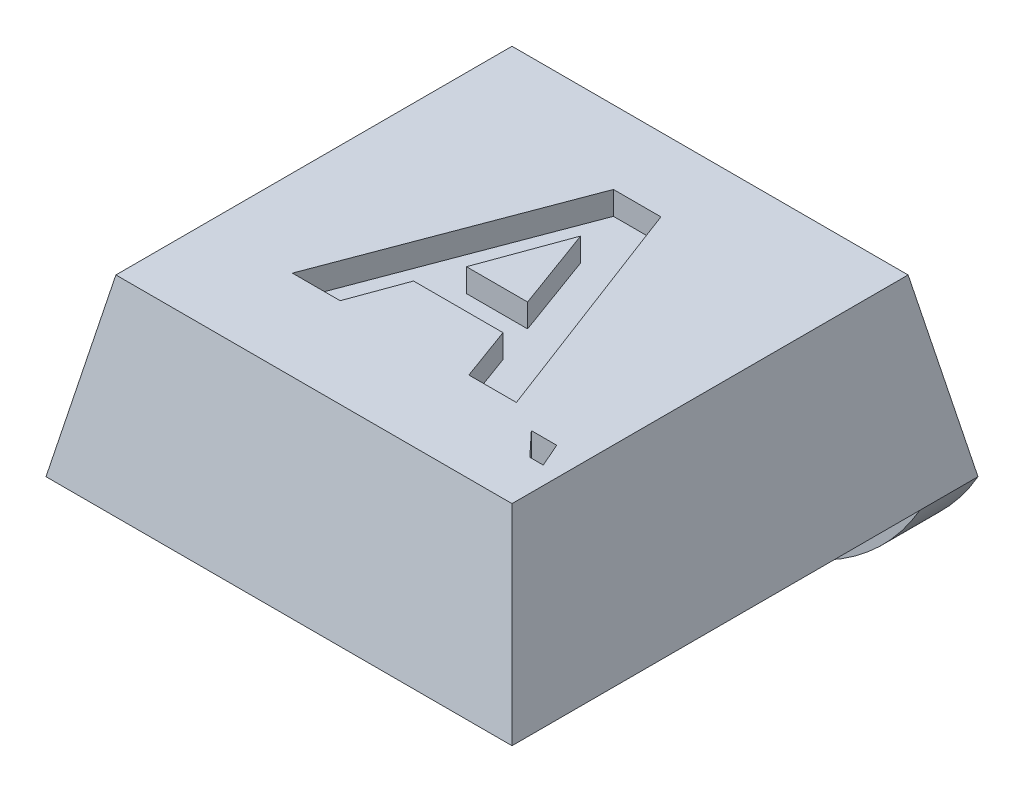
from build123d import *

# Parameters (mm, degrees)
SKETCH1_W               = 8
SKETCH1_H               = 8
BOSS_EXTRUDE1_DEPTH     = 3
CUT_EXTRUDE1_DEPTH      = 12.704699911
CUT_EXTRUDE1_DEPTH_BACK = 12.704699911
CUT_EXTRUDE2_DEPTH      = 11
SKETCH4_R               = 1.75
CUT_EXTRUDE3_DEPTH      = 0.4
SKETCH5_W               = 8
SKETCH5_H               = 1
BOSS_EXTRUDE2_DEPTH     = 2
FILLET1_R               = 4
CUT_EXTRUDE4_DEPTH      = 0.4
CUT_EXTRUDE5_DEPTH      = 0.5


with BuildPart() as part:
    # Sketch1 → Boss-Extrude1 (new body)
    with BuildSketch(Plane(origin=(0, 0, 0), x_dir=(1, 0, 0), z_dir=(0, 1, 0))):
        with Locations((4, 4)):
            Rectangle(SKETCH1_W, SKETCH1_H)
    extrude(amount=BOSS_EXTRUDE1_DEPTH)

    # Sketch2 → Cut-Extrude1 (cut, two sides: drawn at the far end of the back side and taken through both)
    with BuildSketch(Plane.XY.offset(-CUT_EXTRUDE1_DEPTH_BACK)):
        Polygon((0, 0), (0.6, 3), (0, 3), align=None)
        Polygon((8, 0), (7.4, 3), (8, 3), align=None)
    extrude(amount=CUT_EXTRUDE1_DEPTH + CUT_EXTRUDE1_DEPTH_BACK, mode=Mode.SUBTRACT)

    # Sketch3 → Cut-Extrude2 (cut)
    with BuildSketch(Plane(origin=(0, 0, 0), x_dir=(0, 0, -1), z_dir=(1, 0, 0))):
        Polygon((0, 0), (0.6, 3), (0, 3), align=None)
        Polygon((8, 3), (7.4, 3), (8, 0), align=None)
    extrude(amount=CUT_EXTRUDE2_DEPTH, mode=Mode.SUBTRACT)

    # Sketch4 → Cut-Extrude3 (cut)
    with BuildSketch(Plane.XZ):
        with Locations(Location((4, -3.75, 0), (0, 0, 270))):
            Circle(SKETCH4_R)
    extrude(amount=-CUT_EXTRUDE3_DEPTH, mode=Mode.SUBTRACT)

    # Sketch5 → Boss-Extrude2 (add)
    with BuildSketch(Plane.XZ):
        with Locations((4, -7.5)):
            Rectangle(SKETCH5_W, SKETCH5_H)
    extrude(amount=BOSS_EXTRUDE2_DEPTH)

    # Fillet1
    # the kernel refuses this fillet: 4 mm, written as the material it takes off along each edge
    with BuildSketch(Plane(origin=(8, -2, -16.660254038), x_dir=(0, 1, 0), z_dir=(0, 0, 1)), Plane(origin=(0, -2, 1.660254038), x_dir=(0, 1, 0), z_dir=(0, 0, -1))) as fillet1_piece_1:
        with BuildLine():
            CenterArc((4, 3.464101615), FILLET1_R, 180, 60)
            Line((0, 3.464101615), (-0.08, 3.464101615))
            Line((-0.08, 3.464101615), (-0.08, 0))
            Line((-0.08, 0), (0, -0.08))
            ThreePointArc((0, -0.08), (1, -0.08), (1.96, -0.069282032))
            Line((1.96, -0.069282032), (2, 0))
        make_face()
    extrude(amount=18.320508076, mode=Mode.SUBTRACT)

    # Sketch6 → Cut-Extrude4 (cut)
    with BuildSketch(Plane(origin=(0, 3, 0), x_dir=(1, 0, 0), z_dir=(0, 1, 0))):
        Polygon((5.933857302, 2.141652068), (5.118152174, 2.141652068), (4.780812431, 3.064728992), (3.24555602, 3.064728992), (2.908216277, 2.141652068), (2.087703456, 2.141652068), (3.599722687, 6.141652068), (4.414626533, 6.141652068), align=None)
        Polygon((4.536421405, 3.731395658), (4.010780379, 5.167293094), (3.486741918, 3.731395658), align=None, mode=Mode.SUBTRACT)
    extrude(amount=-CUT_EXTRUDE4_DEPTH, mode=Mode.SUBTRACT)

    # Sketch7 → Cut-Extrude5 (cut)
    with BuildSketch(Plane(origin=(0, 3, 0), x_dir=(1, 0, 0), z_dir=(0, 1, 0))):
        Polygon((7.095591712, 1.44126633), (6.864822481, 1.44126633), (6.480207097, 1.85152274), (6.916104533, 1.85152274), align=None)
    extrude(amount=-CUT_EXTRUDE5_DEPTH, mode=Mode.SUBTRACT)


solid = part.part
